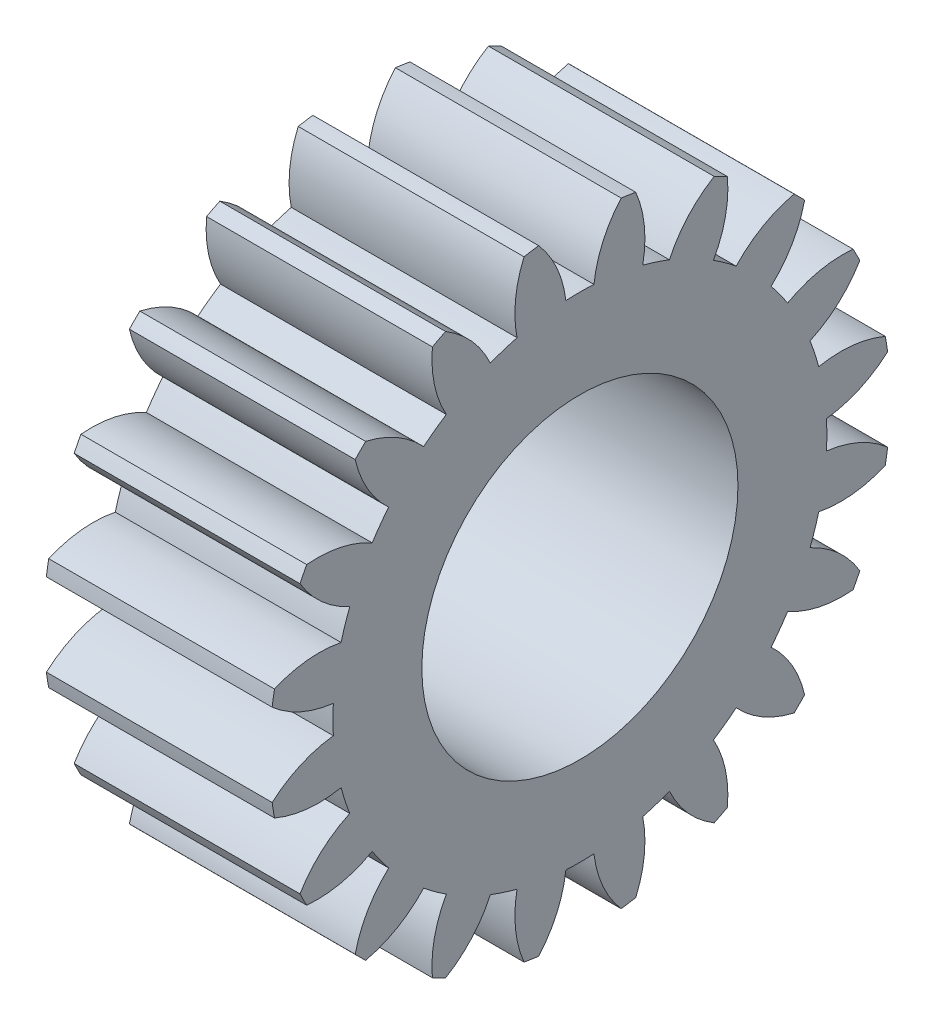
from build123d import *

# Parameters (mm, degrees)
BASPROSKE_W     = 10
BASPROSKE_H     = 13.75
TOOTHCUT_DEPTH  = 22.866069606
TEETHCUTS_COUNT = 20
TEETHCUTS_ANGLE = 342
BORSKE_R        = 7
BORE_DEPTH      = 50.0000508


with BuildPart() as part:
    # BasProSke → Base-Revolve (revolve)
    with BuildSketch(Plane(origin=(0, 0, 0), x_dir=(1, 0, 0), z_dir=(0, 1, 0))):
        with Locations((5, 6.875)):
            Rectangle(BASPROSKE_W, BASPROSKE_H)
    revolve(axis=Axis((-10, 0, 0), (1, 0, 0)))

    # TooCutSke → ToothCut (cut, through all)
    with BuildSketch(Plane(origin=(0, 0, 0), x_dir=(0, 0, -1), z_dir=(1, 0, 0))):
        with BuildLine():
            ThreePointArc((0.62110296, 10.918848994), (0, 10.9365), (-0.62110296, 10.918848994))
            ThreePointArc((-0.62110296, 10.918848994), (-1.024517052, 12.378857135), (-1.846615859, 13.651067908))
            ThreePointArc((-1.846615859, 13.651067908), (0, 13.7754), (1.846615859, 13.651067908))
            ThreePointArc((1.846615859, 13.651067908), (1.024517052, 12.378857135), (0.62110296, 10.918848994))
        make_face()
    toothcut = extrude(amount=TOOTHCUT_DEPTH, mode=Mode.SUBTRACT)

    # TeethCuts: ToothCut ×20 about axis
    teethcuts_axis = Axis((-10, 0, 0), (1, 0, 0))
    for i in range(1, TEETHCUTS_COUNT):
        add(toothcut.rotate(teethcuts_axis, i * TEETHCUTS_ANGLE / (TEETHCUTS_COUNT - 1)), mode=Mode.SUBTRACT)

    # BorSke → Bore (cut, symmetric)
    with BuildSketch(Plane(origin=(0, 0, 0), x_dir=(0, 0, -1), z_dir=(1, 0, 0))):
        Circle(BORSKE_R)
    extrude(amount=BORE_DEPTH, both=True, mode=Mode.SUBTRACT)


solid = part.part
